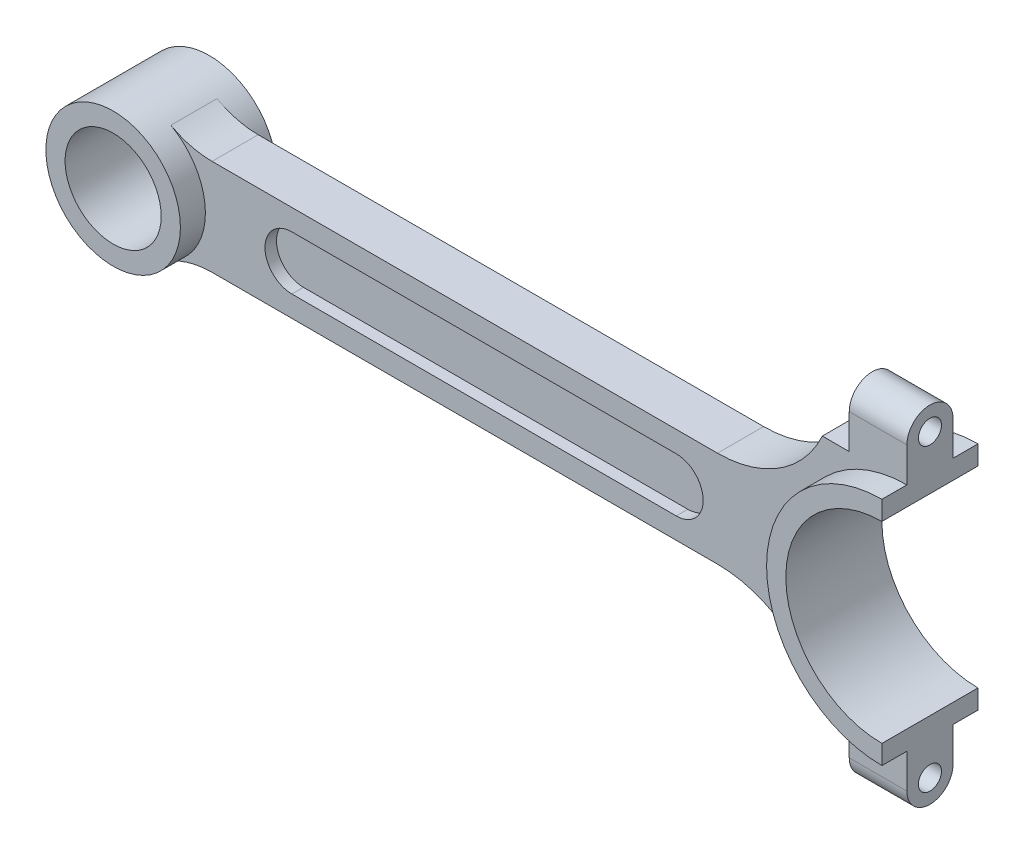
from build123d import *

# Parameters (mm, degrees)
SKETCH1_R             = 35
SKETCH1_R_2           = 25
BOSS_EXTRUDE1_DEPTH   = 25
BOSS_EXTRUDE1_2_DEPTH = 25
BOSS_EXTRUDE3_DEPTH   = 12
FILLET1_R             = 44
FILLET2_R             = 60
SKETCH3_R             = 6
BOSS_EXTRUDE4_DEPTH   = 30
CUT_EXTRUDE1_DEPTH    = 6


with BuildPart() as part:
    # Sketch1 → Boss-Extrude1 (new, symmetric)
    with BuildSketch(Plane.XY):
        Circle(SKETCH1_R)
        Circle(SKETCH1_R_2, mode=Mode.SUBTRACT)
    extrude(amount=BOSS_EXTRUDE1_DEPTH, both=True)



with BuildPart() as body_2:
    # Sketch1 → Boss-Extrude1 2 (new, symmetric)
    with BuildSketch(Plane.XY):
        with BuildLine():
            Line((400, 50), (400, 60))
            ThreePointArc((400, 60), (340, 0), (400, -60))
            Line((400, -60), (400, -50))
            ThreePointArc((400, -50), (350, 0), (400, 50))
        make_face()
    extrude(amount=BOSS_EXTRUDE1_2_DEPTH, both=True)


with BuildPart() as part_1:
    add(part.part)

    add(body_2.part)  # Boss-Extrude3 merges body 2
    # Sketch2 → Boss-Extrude3 (add, symmetric)
    with BuildSketch(Plane.XY):
        with BuildLine():
            Line((35, 25), (340, 25))
            Line((340, 25), (356, 60))
            Line((356, 60), (400, 60))
            ThreePointArc((400, 60), (340, 0), (400, -60))
            Line((400, -60), (356, -60))
            Line((356, -60), (340, -25))
            Line((340, -25), (35, -25))
            Line((35, -25), (24.494897428, -25))
            ThreePointArc((24.494897428, -25), (35, 0), (24.494897428, 25))
            Line((24.494897428, 25), (35, 25))
        make_face()
    extrude(amount=BOSS_EXTRUDE3_DEPTH, both=True)

    # Fillet1
    fillet1_edges = [part_1.edges().sort_by_distance(p)[0] for p in [
        (24.494897428, 25, 0),
        (24.494897428, -25, 0),
    ]]
    fillet(fillet1_edges, radius=FILLET1_R)

    # Fillet2
    # the kernel refuses this fillet: 60 mm, written as the material it adds along each edge
    with BuildSketch(Plane(origin=(340, -25, 12), x_dir=(-1, 0, 0), z_dir=(0, 0, -1))) as fillet2_piece_1_section:
        with BuildLine():
            CenterArc((FILLET2_R * 0.642393223137, -FILLET2_R), FILLET2_R, 90, 65.432828679)
            Line((-FILLET2_R * 0.267081252449, -FILLET2_R * 0.584240239732), (0, 0))
            Line((0, 0), (FILLET2_R * 0.642393223137, 0))
        make_face()
    fillet2_piece_1 = extrude(amount=24, mode=Mode.PRIVATE)
    fillet2_piece_1 = split(fillet2_piece_1, bisect_by=Plane(origin=(335.089440869, -60, 0), z_dir=(0, 1, 0)), keep=Keep.TOP, mode=Mode.PRIVATE)
    add(fillet2_piece_1)
    with BuildSketch(Plane(origin=(340, 25, 12), x_dir=(0.41575976026779565, 0.9094744755857994, 0), z_dir=(0, 0, -1))) as fillet2_piece_2_section:
        with BuildLine():
            CenterArc((FILLET2_R * 0.642393223137, -FILLET2_R), FILLET2_R, 90, 65.432828679)
            Line((-FILLET2_R * 0.267081252449, -FILLET2_R * 0.584240239732), (0, 0))
            Line((0, 0), (FILLET2_R * 0.642393223137, 0))
        make_face()
    fillet2_piece_2 = extrude(amount=24, mode=Mode.PRIVATE)
    fillet2_piece_2 = split(fillet2_piece_2, bisect_by=Plane(origin=(335.089440869, 60, 0), z_dir=(0, -1, 0)), keep=Keep.TOP, mode=Mode.PRIVATE)
    add(fillet2_piece_2)

    # Sketch3 → Boss-Extrude4 (add)
    with BuildSketch(Plane(origin=(400, 0, 0), x_dir=(0, 0, -1), z_dir=(1, 0, 0))):
        with BuildLine():
            Line((-12, 78), (-12, 60))
            Line((-12, 60), (12, 60))
            Line((12, 60), (12, 78))
            ThreePointArc((12, 78), (0, 90), (-12, 78))
        make_face()
        with Locations((0, 78)):
            Circle(SKETCH3_R, mode=Mode.SUBTRACT)
    boss_extrude4 = extrude(amount=-BOSS_EXTRUDE4_DEPTH)

    # Mirror1: Boss-Extrude4 across plane
    add(boss_extrude4.mirror(Plane.ZX))

    # Sketch4 → Cut-Extrude1 (cut)
    with BuildSketch(Plane.XY.offset(12)):
        with BuildLine():
            Line((280, -14), (80, -14))
            ThreePointArc((80, -14), (66, 0), (80, 14))
            Line((80, 14), (280, 14))
            ThreePointArc((280, 14), (294, 0), (280, -14))
        make_face()
    cut_extrude1 = extrude(amount=-CUT_EXTRUDE1_DEPTH, mode=Mode.SUBTRACT)

    # Mirror2: Cut-Extrude1 across plane
    add(cut_extrude1.mirror(Plane.XY), mode=Mode.SUBTRACT)


solid = part_1.part
